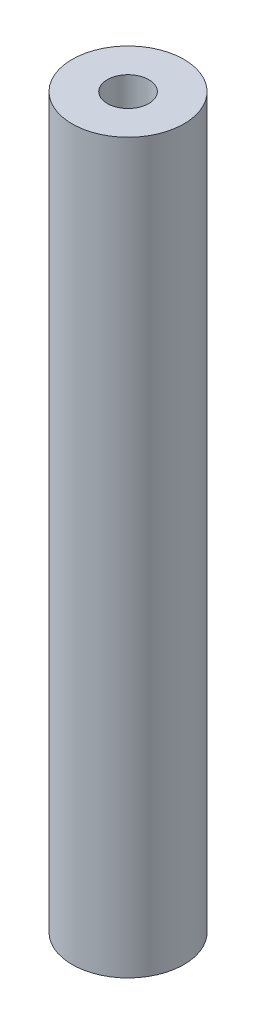
from build123d import *

# Parameters (mm, degrees)
SKETCH1_R           = 5.715
SKETCH1_R_2         = 2.1209
BOSS_EXTRUDE1_DEPTH = 74.422


with BuildPart() as part:
    # Sketch1 → Boss-Extrude1 (new body)
    with BuildSketch(Plane(origin=(0, 0, 0), x_dir=(1, 0, 0), z_dir=(0, 1, 0))):
        Circle(SKETCH1_R)
        Circle(SKETCH1_R_2, mode=Mode.SUBTRACT)
    extrude(amount=BOSS_EXTRUDE1_DEPTH)


solid = part.part
